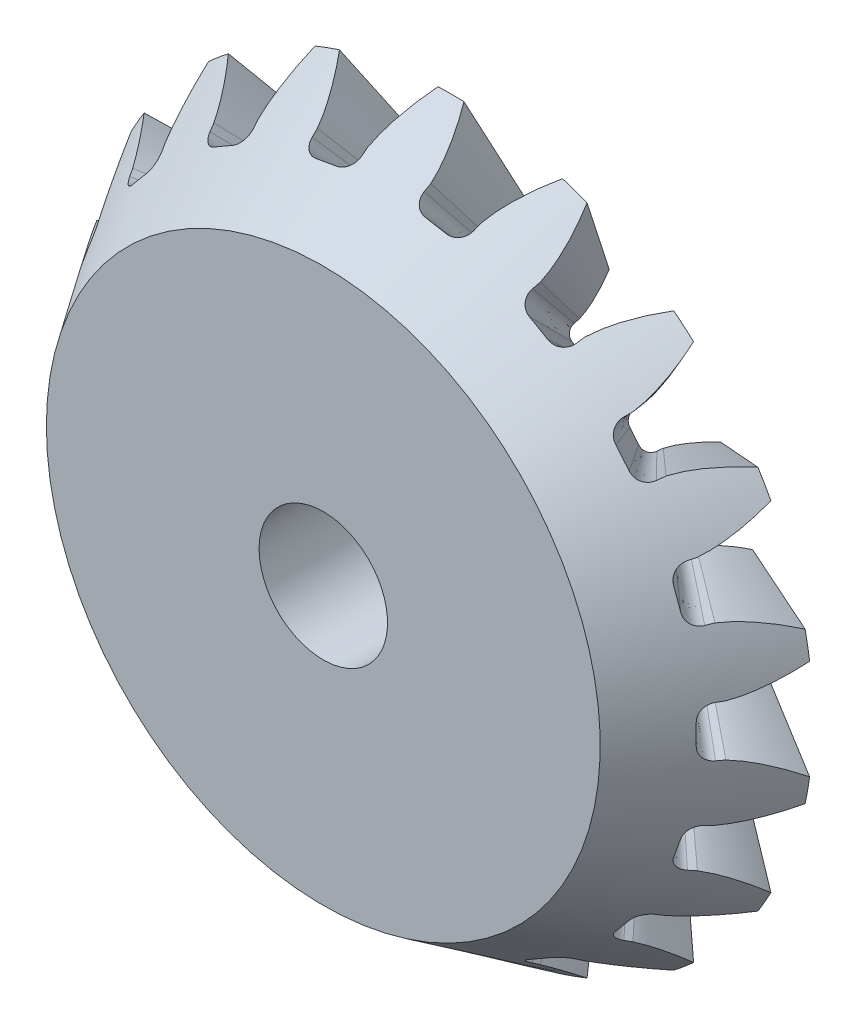
from build123d import *

# Parameters (mm, degrees)
TEETH_COUNT = 18


with BuildPart() as part:
    # Blank Sketch → Blank (revolve)
    with BuildSketch(Plane(origin=(0, 0, 0), x_dir=(1, 0, 0), z_dir=(0, 1, 0))):
        Polygon((11.175952386, -15.761090681), (15.613547075, -9.104698648), (23.532358699, -13.451461952), (17.998148625, -21.752777062), (4.175, -21.752777062), (4.175, -15.761090681), align=None)
    revolve(axis=Axis((0, 0, 0), (0, 0, 1)))

    # Heel Section Sketch for Tooth Space → Tooth Space section 0
    with BuildSketch(Plane(origin=(24.580125736, 0, 16.386750491), x_dir=(0.5547001962252293, 0, -0.8320502943378437), z_dir=(0.8320502943378437, 0, 0.5547001962252293))):
        with BuildLine():
            Line((-2.42539602, 1.821968908), (-2.956815193, 1.798853671))
            # circular arc as an exact rational Bezier (weights 1, cos(half-angle), 1)
            Bezier((-2.956815193, 1.798853671), (-3.967992852, 1.754870292), (-3.949367049, 0.742907904), weights=[1, 0.715913265, 1])
            Bezier((-3.949367049, 0.742907904), (-3.935693363, 0), (-3.949367049, -0.742907904), weights=[1, 0.999830659, 1])
            Bezier((-3.949367049, -0.742907904), (-3.967992852, -1.754870292), (-2.956815193, -1.798853671), weights=[1, 0.715913265, 1])
            Line((-2.956815193, -1.798853671), (-2.42539602, -1.821968908))
            add(Edge.make_bspline(
                [(-2.42539602, -1.821968908), (-2.391324828, -1.827483283), (-2.324026886, -1.839225521), (-2.166585049, -1.868592509), (-2.003640701, -1.905723568), (-1.781203594, -1.959346183), (-1.566437566, -2.01947932), (-1.329034528, -2.090192122), (-1.102661125, -2.164452234), (-0.872205891, -2.244421514), (-0.646794518, -2.328057222), (-0.412032101, -2.419760361), (-0.12470869, -2.538047642), (0.217023884, -2.688063111), (0.606958249, -2.870956995), (1.04076183, -3.090520869), (1.463356475, -3.317390697), (1.888220198, -3.561183173), (2.294181808, -3.804634897), (2.715686033, -4.074172269), (3.096473158, -4.325014688), (3.529166193, -4.629534592), (3.860912731, -4.867023382), (4.223899284, -5.143979157), (4.388659835, -5.271719417), (4.473110407, -5.338173134)],
                knots=[0.022116874, 0.022116874, 0.022116874, 0.022116874, 0.022116874, 0.03978681, 0.05812626, 0.08161386, 0.109122181, 0.136629642, 0.164137604, 0.191645235, 0.219153123, 0.246660851, 0.274168534, 0.305931197, 0.36094664, 0.415962165, 0.47097753, 0.525993142, 0.581008615, 0.636024058, 0.691039545, 0.746054991, 0.801070505, 0.856085921, 0.911101539, 0.911101539, 0.911101539, 0.911101539, 0.911101539], degree=4))
            Line((4.473110407, -5.338173134), (4.473110407, 5.338173134))
            add(Edge.make_bspline(
                [(-2.42539602, 1.821968908), (-2.391324828, 1.827483283), (-2.324026886, 1.839225521), (-2.166585049, 1.868592509), (-2.003640701, 1.905723568), (-1.781203594, 1.959346183), (-1.566437566, 2.01947932), (-1.329034528, 2.090192122), (-1.102661125, 2.164452234), (-0.872205891, 2.244421514), (-0.646794518, 2.328057222), (-0.412032101, 2.419760361), (-0.12470869, 2.538047642), (0.217023884, 2.688063111), (0.606958249, 2.870956995), (1.04076183, 3.090520869), (1.463356475, 3.317390697), (1.888220198, 3.561183173), (2.294181808, 3.804634897), (2.715686033, 4.074172269), (3.096473158, 4.325014688), (3.529166193, 4.629534592), (3.860912731, 4.867023382), (4.223899284, 5.143979157), (4.388659835, 5.271719417), (4.473110407, 5.338173134)],
                knots=[0.022116874, 0.022116874, 0.022116874, 0.022116874, 0.022116874, 0.03978681, 0.05812626, 0.08161386, 0.109122181, 0.136629642, 0.164137604, 0.191645235, 0.219153123, 0.246660851, 0.274168534, 0.305931197, 0.36094664, 0.415962165, 0.47097753, 0.525993142, 0.581008615, 0.636024058, 0.691039545, 0.746054991, 0.801070505, 0.856085921, 0.911101539, 0.911101539, 0.911101539, 0.911101539, 0.911101539], degree=4))
        make_face()
    # Toe Section Sketch for Tooth Space → Tooth Space section 1
    with BuildSketch(Plane(origin=(12.931421615, 0, 8.620947743), x_dir=(0.5547001962252294, 0, -0.8320502943378435), z_dir=(0.8320502943378435, 0, 0.5547001962252294))):
        with BuildLine():
            Line((-1.275982835, 0.958524312), (-1.555558515, 0.946363558))
            Bezier((-1.555558515, 0.946363558), (-2.087531573, 0.923224229), (-2.077732676, 0.390838331), weights=[1, 0.715913265, 1])
            Bezier((-2.077732676, 0.390838331), (-2.070539051, 0), (-2.077732676, -0.390838331), weights=[1, 0.999830659, 1])
            Bezier((-2.077732676, -0.390838331), (-2.087531573, -0.923224229), (-1.555558515, -0.946363558), weights=[1, 0.715913265, 1])
            Line((-1.555558515, -0.946363558), (-1.275982835, -0.958524312))
            add(Edge.make_bspline(
                [(-1.275982835, -0.958524312), (-1.258058234, -0.961425384), (-1.221753035, -0.967757782), (-1.141653735, -0.982749198), (-1.052475078, -1.002854954), (-0.938241884, -1.030605912), (-0.823345692, -1.062555949), (-0.699656683, -1.099558105), (-0.579815366, -1.138750266), (-0.459036117, -1.180743427), (-0.34017197, -1.22479191), (-0.216824152, -1.273006871), (-0.065565619, -1.335257223), (0.114142986, -1.414161746), (0.319339387, -1.51039702), (0.547519251, -1.625892023), (0.769878245, -1.745264637), (0.993358219, -1.873498121), (1.206979369, -2.001610381), (1.428663281, -2.143361908), (1.629088215, -2.275402219), (1.856585864, -2.435499346), (2.031314719, -2.560596883), (2.222069912, -2.706136797), (2.308841349, -2.773412437), (2.353270168, -2.808373244)],
                knots=[0.022116874, 0.022116874, 0.022116874, 0.022116874, 0.022116874, 0.03978681, 0.05812626, 0.08161386, 0.109122181, 0.136629642, 0.164137604, 0.191645235, 0.219153123, 0.246660851, 0.274168534, 0.305931197, 0.36094664, 0.415962165, 0.47097753, 0.525993142, 0.581008615, 0.636024058, 0.691039545, 0.746054991, 0.801070505, 0.856085921, 0.911101539, 0.911101539, 0.911101539, 0.911101539, 0.911101539], degree=4))
            Line((2.353270168, -2.808373244), (2.353270168, 2.808373244))
            add(Edge.make_bspline(
                [(-1.275982835, 0.958524312), (-1.258058234, 0.961425384), (-1.221753035, 0.967757782), (-1.141653735, 0.982749198), (-1.052475078, 1.002854954), (-0.938241884, 1.030605912), (-0.823345692, 1.062555949), (-0.699656683, 1.099558105), (-0.579815366, 1.138750266), (-0.459036117, 1.180743427), (-0.34017197, 1.22479191), (-0.216824152, 1.273006871), (-0.065565619, 1.335257223), (0.114142986, 1.414161746), (0.319339387, 1.51039702), (0.547519251, 1.625892023), (0.769878245, 1.745264637), (0.993358219, 1.873498121), (1.206979369, 2.001610381), (1.428663281, 2.143361908), (1.629088215, 2.275402219), (1.856585864, 2.435499346), (2.031314719, 2.560596883), (2.222069912, 2.706136797), (2.308841349, 2.773412437), (2.353270168, 2.808373244)],
                knots=[0.022116874, 0.022116874, 0.022116874, 0.022116874, 0.022116874, 0.03978681, 0.05812626, 0.08161386, 0.109122181, 0.136629642, 0.164137604, 0.191645235, 0.219153123, 0.246660851, 0.274168534, 0.305931197, 0.36094664, 0.415962165, 0.47097753, 0.525993142, 0.581008615, 0.636024058, 0.691039545, 0.746054991, 0.801070505, 0.856085921, 0.911101539, 0.911101539, 0.911101539, 0.911101539, 0.911101539], degree=4))
        make_face()
    tooth_space = loft(mode=Mode.SUBTRACT)

    # Teeth: Tooth Space ×18 about axis
    teeth_axis = Axis((0, 0, -1.352081728), (0, 0, 1))
    for i in range(1, TEETH_COUNT):
        add(tooth_space.rotate(teeth_axis, i * 360 / TEETH_COUNT), mode=Mode.SUBTRACT)


solid = part.part
